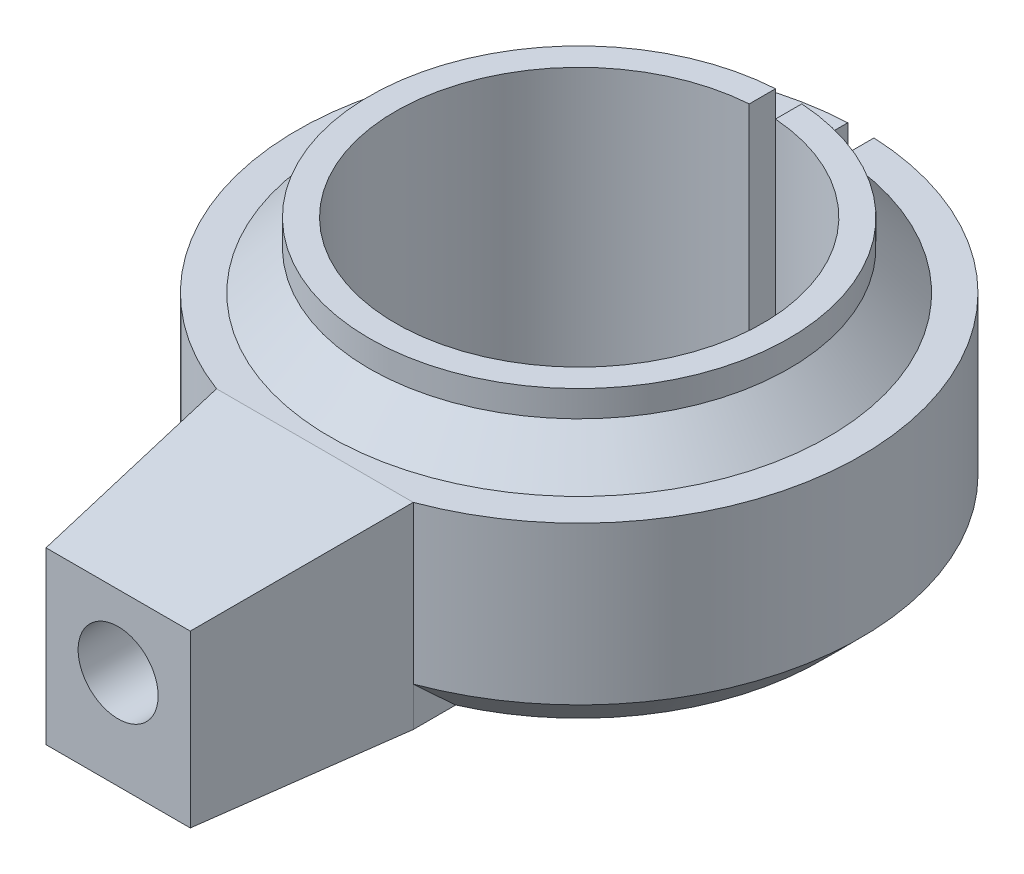
from build123d import *
from OCP.BRepFilletAPI import BRepFilletAPI_MakeChamfer

# Parameters (mm, degrees)
BOSS_EXTRUDE1_DEPTH     = 15
SKETCH2_R               = 3.05
CUT_EXTRUDE1_DEPTH      = 15
BOSS_EXTRUDE2_DEPTH     = 5
CHAMFER4_SIZE           = 3
CHAMFER6_SIZE           = 15
CHAMFER6_SIZE_2         = 2
CUT_EXTRUDE2_DEPTH      = 29
CUT_EXTRUDE2_DEPTH_BACK = 25
SKETCH4_R               = 1.5
SKETCH5_R               = 2.5
CUT_EXTRUDE3_DEPTH      = 20.5
SKETCH6_R               = 3
CUT_EXTRUDE4_DEPTH      = 15.5


with BuildPart() as part:
    # Sketch1 → Boss-Extrude1 (new body)
    with BuildSketch(Plane(origin=(0, 0, 0), x_dir=(1, 0, 0), z_dir=(0, 1, 0))):
        with BuildLine():
            ThreePointArc((-14.719179189, 17.95673597), (-15.719179189, -10.007504074), (-16.719179189, 17.95673597))
            Line((-16.719179189, 17.95673597), (-16.719179189, 25.469227521))
            ThreePointArc((-16.719179189, 25.469227521), (-36.961756137, 7.309561592), (-23.219179189, -16.156945753))
            Line((-23.219179189, -16.156945753), (-23.219179189, -31.156945753))
            Line((-23.219179189, -31.156945753), (-8.219179189, -31.156945753))
            Line((-8.219179189, -31.156945753), (-8.219179189, -16.156945753))
            ThreePointArc((-8.219179189, -16.156945753), (5.523397758, 7.309561592), (-14.719179189, 25.469227521))
            Line((-14.719179189, 25.469227521), (-14.719179189, 17.95673597))
        make_face()
    extrude(amount=BOSS_EXTRUDE1_DEPTH)

    # Sketch2 → Cut-Extrude1 (cut)
    with BuildSketch(Plane.XY.offset(31.156945753)):
        with Locations((-15.719179189, 7.5)):
            Circle(SKETCH2_R)
    extrude(amount=-CUT_EXTRUDE1_DEPTH, mode=Mode.SUBTRACT)

    # Sketch3 → Boss-Extrude2 (add)
    with BuildSketch(Plane(origin=(0, 15, 0), x_dir=(1, 0, 0), z_dir=(0, 1, 0))):
        with BuildLine():
            Line((-16.719179189, 17.95673597), (-16.719179189, 19.961215349))
            ThreePointArc((-16.719179189, 19.961215349), (-26.673630339, -7.669407863), (0.280820811, 3.992495926))
            ThreePointArc((0.280820811, 3.992495926), (-4.0572754, 14.946947076), (-14.719179189, 19.961215349))
            Line((-14.719179189, 19.961215349), (-14.719179189, 17.95673597))
            ThreePointArc((-14.719179189, 17.95673597), (-15.719179189, -10.007504074), (-16.719179189, 17.95673597))
        make_face()
    extrude(amount=BOSS_EXTRUDE2_DEPTH)

    # Chamfer4
    chamfer4_edges = [part.edges().sort_by_distance(p)[0] for p in [
        (-26.673630339, 15, 7.669407863),
        (-36.961756137, 0, -7.309561592),
        (5.523397758, 0, -7.309561592),
    ]]
    chamfer(chamfer4_edges, length=CHAMFER4_SIZE)

    # Chamfer6
    chamfer6_edges_1 = [part.edges().sort_by_distance(p)[0] for p in [
        (-23.219179189, 7.5, 31.156945753),
    ]]
    chamfer6_side_1 = [part.faces().sort_by_distance(p)[0] for p in [
        (-23.219179189, 7.5, 31.116945753),
    ]]
    chamfer6_edges_2 = [part.edges().sort_by_distance(p)[0] for p in [
        (-8.219179189, 7.5, 31.156945753),
    ]]
    chamfer6_side_2 = [part.faces().sort_by_distance(p)[0] for p in [
        (-8.259179189, 7.5, 31.156945753),
    ]]
    chamfer6_edges_3 = [part.edges().sort_by_distance(p)[0] for p in [
        (-15.719179189, 15, 31.156945753),
    ]]
    chamfer6_side_3 = [part.faces().sort_by_distance(p)[0] for p in [
        (-15.719179189, 14.96, 31.156945753),
    ]]
    chamfer6 = BRepFilletAPI_MakeChamfer(part.part.solid().wrapped)
    for e in chamfer6_edges_1:
        chamfer6.Add(CHAMFER6_SIZE - 0.0001, CHAMFER6_SIZE_2 - 0.0001, e.wrapped, chamfer6_side_1[0].wrapped)
    for e in chamfer6_edges_2:
        chamfer6.Add(CHAMFER6_SIZE_2 - 0.0001, CHAMFER6_SIZE - 0.0001, e.wrapped, chamfer6_side_2[0].wrapped)
    for e in chamfer6_edges_3:
        chamfer6.Add(CHAMFER6_SIZE_2 - 0.0001, CHAMFER6_SIZE - 0.0001, e.wrapped, chamfer6_side_3[0].wrapped)
    add(Compound.cast(chamfer6.Shape()), mode=Mode.REPLACE)  # a hair under: the kernel refuses the full size

    # Sketch4 → Cut-Extrude2 (cut, two sides: drawn at the far end of the back side and taken through both)
    with BuildSketch(Plane.ZY.offset(14.719179189).offset(-CUT_EXTRUDE2_DEPTH_BACK)):
        with Locations(Location((-21.469227521, 7.5, 0), (0, 0, 180))):
            Circle(SKETCH4_R)
    extrude(amount=CUT_EXTRUDE2_DEPTH + CUT_EXTRUDE2_DEPTH_BACK, mode=Mode.SUBTRACT)

    # Sketch5 → Cut-Extrude3 (cut)
    with BuildSketch(Plane(origin=(5.780820811, 0, 0), x_dir=(0, 0, -1), z_dir=(1, 0, 0))):
        with Locations((21.469227521, 7.5)):
            Circle(SKETCH5_R)
    extrude(amount=-CUT_EXTRUDE3_DEPTH, mode=Mode.SUBTRACT)

    # Sketch6 → Cut-Extrude4 (cut)
    with BuildSketch(Plane.ZY.offset(37.219179189)):
        with Locations((-21.469227521, 7.5)):
            Circle(SKETCH6_R)
    extrude(amount=-CUT_EXTRUDE4_DEPTH, mode=Mode.SUBTRACT)


solid = part.part
